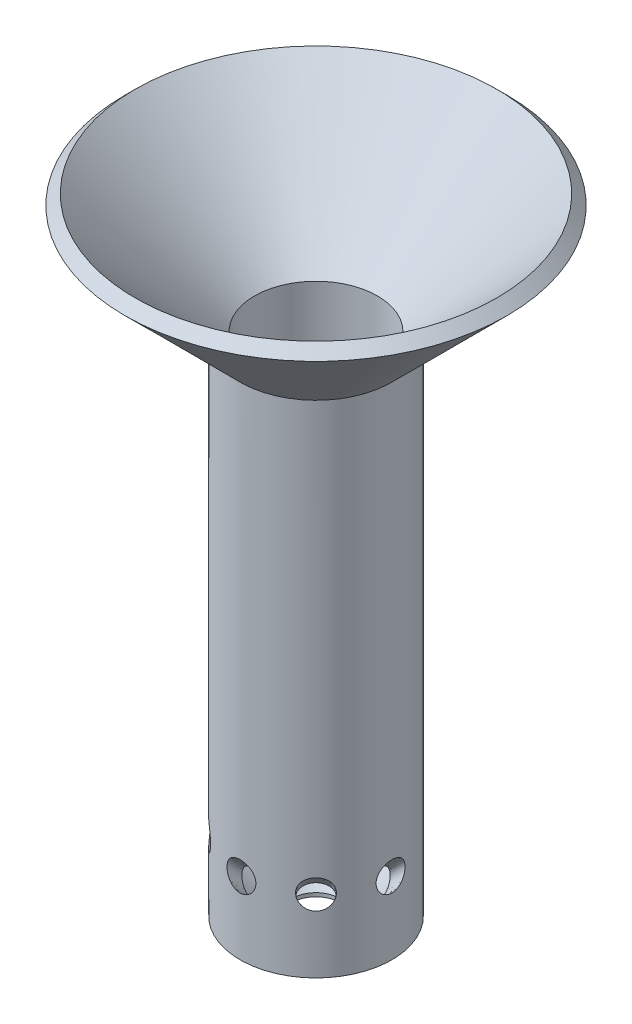
from build123d import *

# Parameters (mm, degrees)
CORTE_EXTRUS_O2_START = -23.410661234
CORTE_EXTRUS_O2_DEPTH = 5.656768244
PADR_OCIRCULAR1_COUNT = 8


# Read off the part's stored shape, not the designer's step: Corte-extrusão2
with BuildPart() as part:
    # Esboço1 → Revolução1 (revolve)
    with BuildSketch(Plane.XY, mode=Mode.PRIVATE) as revolu_o1_sk:
        Polygon((8.5, 22.392205482), (8.5, -32.607794518), (7, -32.607794518), (8.5, -35.20587073), (8.5, -42.607794518), (3.25, -47.107794518), (3.25, -47.607794518), (10.5, -47.607794518), (10.5, 21.563778357), (26.414213562, 37.477991919), (25, 38.892205482), align=None)
    revolve(revolu_o1_sk.sketch.rotate(Axis((0, 30.139719614, 0), (0, -1, 0)), 180), axis=Axis((0, 30.139719614, 0), (0, -1, 0)))

    # Corte-extrusão2 outline → Corte-extrusão2 (cut)
    with BuildSketch(Plane(origin=(0, 0, 0), x_dir=(1, 0, 0), z_dir=(0, 0.707106781186544, 0.7071067811865511)).offset(CORTE_EXTRUS_O2_START)):
        with BuildLine():
            add(Edge.make_bspline(
                [(-2, -33.848600815), (-2, -33.473466385), (-1.781636382, -33.149488821), (-1.046456862, -32.717464725), (-0.525031314, -32.60330815), (0.522577153, -32.602960596), (1.043139447, -32.715494911), (1.785074005, -33.151529279), (1.999779145, -33.478142528), (2.000220499, -34.217865989), (1.783888454, -34.627593971), (1.046906284, -35.237597645), (0.529025519, -35.431295434), (-0.526721671, -35.431826575), (-1.04580997, -35.237669471), (-1.78081339, -34.630970081), (-2, -34.223735244), (-2, -33.848600815)],
                knots=[0, 0, 0, 0, 0.125, 0.125, 0.25, 0.25, 0.375, 0.375, 0.5, 0.5, 0.625, 0.625, 0.75, 0.75, 0.875, 0.875, 1, 1, 1, 1], degree=3))
        make_face()
    corte_extrus_o2 = extrude(amount=CORTE_EXTRUS_O2_DEPTH, mode=Mode.SUBTRACT)

    # PadrãoCircular1: Corte-extrusão2 ×8 about axis, 4 skipped
    padr_ocircular1_axis = Axis((0, 30.139719614, 0), (0, 1, 0))
    add([corte_extrus_o2.rotate(padr_ocircular1_axis, i * 360 / PADR_OCIRCULAR1_COUNT) for i in range(1, PADR_OCIRCULAR1_COUNT) if i not in (3, 4, 5, 6)], mode=Mode.SUBTRACT)


solid = part.part
